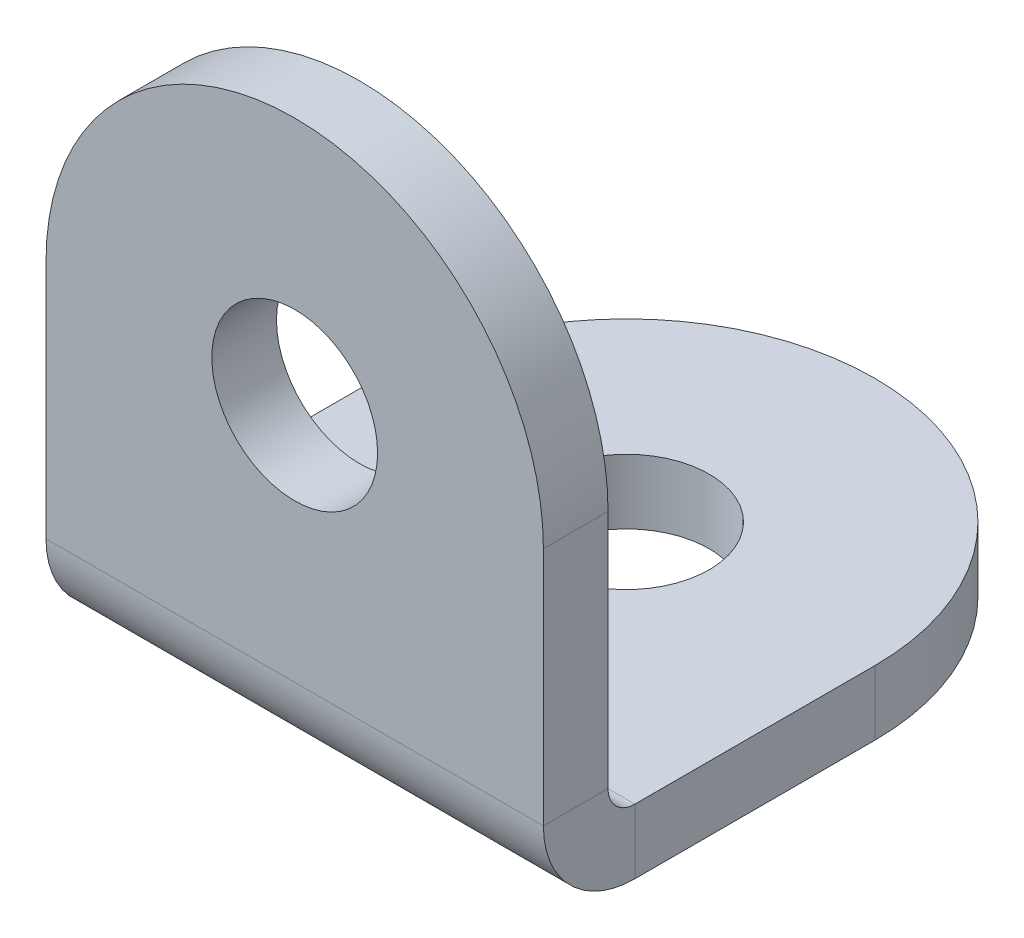
from build123d import *

# Parameters (mm, degrees)
RESSALTO_EXTRUS_O1_DEPTH  = 7.5
CONVERTER_S_LIDO1_START   = -7.5
CONVERTER_S_LIDO1_DEPTH   = 15
CONVERTER_S_LIDO1_2_DEPTH = 15
ESBO_O6_R                 = 2.5
CORTE_EXTRUS_O1_DEPTH     = 2
ESBO_O7_R                 = 2.5
CORTE_EXTRUS_O2_DEPTH     = 2


# Read off the part's stored shape, not the designer's step: Converter-Sólido1
with BuildPart() as part:
    # Esboço1 → Ressalto-extrusão1 (new, symmetric)
    with BuildSketch(Plane(origin=(0, 0, 0), x_dir=(0, 0, -1), z_dir=(1, 0, 0))):
        Polygon((-8, 10), (-8, -8), (10, -8), (10, -10), (-10, -10), (-10, 10), align=None)
    extrude(amount=RESSALTO_EXTRUS_O1_DEPTH, both=True)

    # Converter-Sólido1 outline → Converter-Sólido1 (cut)
    with BuildSketch(Plane.YZ.offset(CONVERTER_S_LIDO1_START)):
        with BuildLine():
            Line((-10, 10), (-10, 7.24))
            ThreePointArc((-10, 7.24), (-9.191614716, 9.191614716), (-7.24, 10))
            Line((-7.24, 10), (-10, 10))
        make_face()
        with BuildLine():
            Line((-8.05, 7.24), (-8.05, -10))
            Line((-8.05, -10), (-8, -10))
            Line((-8, -10), (-8, 7.520178515))
            ThreePointArc((-8, 7.520178515), (-8.037402032, 7.382302495), (-8.05, 7.24))
        make_face()
        with BuildLine():
            Line((10, 8), (10, 8.05))
            Line((10, 8.05), (-7.24, 8.05))
            ThreePointArc((-7.24, 8.05), (-7.382302495, 8.037402032), (-7.520178515, 8))
            Line((-7.520178515, 8), (10, 8))
        make_face()
    extrude(amount=CONVERTER_S_LIDO1_DEPTH, mode=Mode.SUBTRACT)

    # Converter-S_lido1 2 outline → Converter-S_lido1 2 (add)
    with BuildSketch(Plane.YZ.offset(CONVERTER_S_LIDO1_START)):
        with BuildLine():
            Line((-8, 8), (-8, 7.520178515))
            ThreePointArc((-8, 7.520178515), (-7.812756493, 7.812756493), (-7.520178515, 8))
            Line((-7.520178515, 8), (-8, 8))
        make_face()
    extrude(amount=CONVERTER_S_LIDO1_2_DEPTH)

    # Esboço6 → Corte-extrusão1 (cut)
    with BuildSketch(Plane.XY.offset(10)):
        Circle(ESBO_O6_R)
        with BuildLine():
            Line((-7.5, 0), (-7.5, 10))
            Line((-7.5, 10), (7.5, 10))
            Line((7.5, 10), (7.5, 0))
            ThreePointArc((7.5, 0), (0, 7.5), (-7.5, 0))
        make_face()
    extrude(amount=-CORTE_EXTRUS_O1_DEPTH, mode=Mode.SUBTRACT)

    # Esboço7 → Corte-extrusão2 (cut)
    with BuildSketch(Plane(origin=(0, -8.05, 0), x_dir=(1, 0, 0), z_dir=(0, 1, 0))):
        with Locations(Location((0, 0, 0), (0, 0, 270))):
            Circle(ESBO_O7_R)
        with BuildLine():
            Line((7.5, 0), (7.5, 10))
            Line((7.5, 10), (-7.5, 10))
            Line((-7.5, 10), (-7.5, 0))
            ThreePointArc((-7.5, 0), (0, 7.5), (7.5, 0))
        make_face()
    extrude(amount=-CORTE_EXTRUS_O2_DEPTH, mode=Mode.SUBTRACT)


solid = part.part
